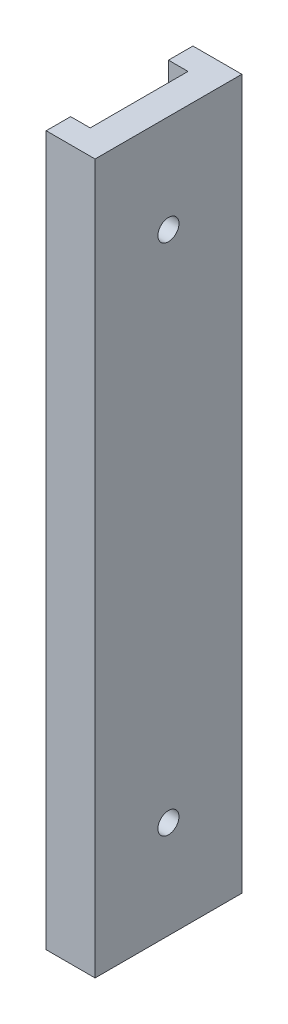
from build123d import *

# Parameters (mm, degrees)
BOSS_EXTRUDE1_DEPTH  = 145
M4_CLEARANCE_HOLE1_D = 4.3


with BuildPart() as part:
    # Sketch1 → Boss-Extrude1 (new body)
    with BuildSketch(Plane(origin=(0, 260, 0), x_dir=(-1, 0, 0), z_dir=(0, -1, 0))):
        Polygon((71.5, -127.5), (61.5, -127.5), (61.5, -97.5), (71.5, -97.5), (71.5, -102.5), (67.5, -102.5), (67.5, -122.5), (71.5, -122.5), align=None)
    extrude(amount=BOSS_EXTRUDE1_DEPTH)

    # M4 Clearance Hole1 (through all)
    with Locations(Plane(origin=(-61.5, 0, 0), x_dir=(0, 0, -1), z_dir=(1, 0, 0))):
        with Locations((-112.5, 240), (-112.5, 135)):
            Hole(M4_CLEARANCE_HOLE1_D / 2)


solid = part.part
